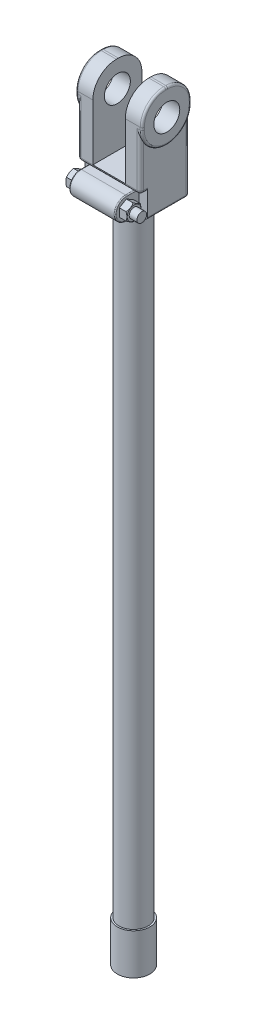
from build123d import *

# Parameters (mm, degrees)
CROQUIS1_R              = 15.875
SALIENTE_EXTRUIR1_DEPTH = 40
CROQUIS2_R              = 14.2875
SALIENTE_EXTRUIR2_DEPTH = 615
CROQUIS3_W              = 65
CROQUIS3_H              = 48
SALIENTE_EXTRUIR3_DEPTH = 105
CROQUIS4_W              = 31.75
CROQUIS4_H              = 48
CORTAR_EXTRUIR1_DEPTH   = 78
REDONDEO1_R             = 23
CROQUIS5_R              = 12.7
CORTAR_EXTRUIR2_DEPTH   = 78
CORTAR_EXTRUIR3_DEPTH   = 2
CORTAR_EXTRUIR4_START   = -2
CORTAR_EXTRUIR4_DEPTH   = 2
REDONDEO3_R             = 3
REDONDEO4_START         = 654
REDONDEO4_DEPTH         = 56.5999999
REDONDEO4_START_2       = 710.5999999
REDONDEO4_2_DEPTH       = 24.0000002
REDONDEO4_START_3       = 27.4999999
REDONDEO4_3_DEPTH       = 3.0000001
REDONDEO4_START_4       = -30.5
REDONDEO4_4_DEPTH       = 3
REDONDEO5_R             = 2
REDONDEO6_R             = 2
CROQUIS9_W              = 7
CROQUIS9_H              = 24
CORTAR_EXTRUIR5_DEPTH   = 80
SALIENTE_EXTRUIR4_DEPTH = 53
REDONDEO7_R             = 3
CORTAR_EXTRUIR6_DEPTH   = 8
CROQUIS14_R             = 4.7625
CORTAR_EXTRUIR7_DEPTH   = 45
SALIENTE_EXTRUIR5_DEPTH = 7.5
CROQUIS16_R             = 6.71931732
CORTAR_EXTRUIR8_DEPTH   = 3
CORTAR_EXTRUIR8_DRAFT   = -64
REDONDEO8_R             = 1
CROQUIS17_R             = 4.7625
SALIENTE_EXTRUIR6_DEPTH = 60
CROQUIS18_R             = 4.7625
SALIENTE_EXTRUIR7_DEPTH = 7.5
CROQUIS19_R             = 6.761258256
CORTAR_EXTRUIR9_DEPTH   = 4
CORTAR_EXTRUIR9_DRAFT   = -52


with BuildPart() as part:
    # Croquis1 → Saliente-Extruir1 (new body)
    with BuildSketch(Plane(origin=(0, 0, 0), x_dir=(1, 0, 0), z_dir=(0, 1, 0))):
        with Locations(Location((0, 0, 0), (0, 0, 270))):
            Circle(CROQUIS1_R)
    extrude(amount=SALIENTE_EXTRUIR1_DEPTH)

    # Croquis2 → Saliente-Extruir2 (add)
    with BuildSketch(Plane(origin=(0, 40, 0), x_dir=(1, 0, 0), z_dir=(0, 1, 0))):
        with Locations(Location((0, 0, 0), (0, 0, 270))):
            Circle(CROQUIS2_R)
    extrude(amount=SALIENTE_EXTRUIR2_DEPTH)

    # Croquis3 → Saliente-Extruir3 (add)
    with BuildSketch(Plane(origin=(0, 655, 0), x_dir=(1, 0, 0), z_dir=(0, 1, 0))):
        Rectangle(CROQUIS3_W, CROQUIS3_H)
    extrude(amount=SALIENTE_EXTRUIR3_DEPTH)

    # Croquis4 → Cortar-Extruir1 (cut)
    with BuildSketch(Plane(origin=(0, 760, 0), x_dir=(1, 0, 0), z_dir=(0, 1, 0))):
        Rectangle(CROQUIS4_W, CROQUIS4_H)
    extrude(amount=-CORTAR_EXTRUIR1_DEPTH, mode=Mode.SUBTRACT)

    # Redondeo1
    redondeo1_edges = [part.edges().sort_by_distance(p)[0] for p in [
        (24.1875, 760, -24),
        (-24.1875, 760, 24),
        (-24.1875, 760, -24),
        (24.1875, 760, 24),
    ]]
    fillet(redondeo1_edges, radius=REDONDEO1_R)

    # Croquis5 → Cortar-Extruir2 (cut)
    with BuildSketch(Plane(origin=(32.5, 0, 0), x_dir=(0, 0, -1), z_dir=(1, 0, 0))):
        with Locations((0, 734.6)):
            Circle(CROQUIS5_R)
    extrude(amount=-CORTAR_EXTRUIR2_DEPTH, mode=Mode.SUBTRACT)

    # Croquis6 → Cortar-Extruir3 (cut)
    with BuildSketch(Plane(origin=(32.5, 0, 0), x_dir=(0, 0, -1), z_dir=(1, 0, 0))):
        with BuildLine():
            Line((24, 734.6), (24, 655))
            Line((24, 655), (-24, 655))
            Line((-24, 655), (-24, 734.6))
            ThreePointArc((-24, 734.6), (0, 710.6), (24, 734.6))
        make_face()
    extrude(amount=-CORTAR_EXTRUIR3_DEPTH, mode=Mode.SUBTRACT)

    # Croquis7 → Cortar-Extruir4 (cut)
    with BuildSketch(Plane.ZY.offset(32.5).offset(CORTAR_EXTRUIR4_START)):
        with BuildLine():
            Line((-24, 734.6), (-24, 655))
            Line((-24, 655), (24, 655))
            Line((24, 655), (24, 734.6))
            ThreePointArc((24, 734.6), (0, 710.6), (-24, 734.6))
        make_face()
    extrude(amount=CORTAR_EXTRUIR4_DEPTH, mode=Mode.SUBTRACT)

    # Redondeo3
    redondeo3_edges = [part.edges().sort_by_distance(p)[0] for p in [
        (30.5, 694.8, -24),
        (-30.5, 694.8, -24),
    ]]
    fillet(redondeo3_edges, radius=REDONDEO3_R)

    # Redondeo4: read off the stored shape, not the designer's step
    # Redondeo4 outline → Redondeo4 (cut)
    with BuildSketch(Plane(origin=(0, 0, 0), x_dir=(1, 0, 0), z_dir=(0, 1, 0)).offset(REDONDEO4_START)):
        with BuildLine():
            ThreePointArc((30.5, -21), (29.621320344, -23.121320344), (27.5, -24))
            Line((27.5, -24), (30.5, -24))
            Line((30.5, -24), (30.5, -21))
        make_face()
        with BuildLine():
            Line((-30.5, -24), (-27.5, -24))
            ThreePointArc((-27.5, -24), (-29.621320344, -23.121320344), (-30.5, -21))
            Line((-30.5, -21), (-30.5, -24))
        make_face()
    extrude(amount=REDONDEO4_DEPTH, mode=Mode.SUBTRACT)

    # Redondeo4 2 outline → Redondeo4 2 (cut)
    with BuildSketch(Plane(origin=(0, 0, 0), x_dir=(1, 0, 0), z_dir=(0, 1, 0)).offset(REDONDEO4_START_2)):
        with BuildLine():
            ThreePointArc((30.5, -21), (29.621320344, -23.121320344), (27.5, -24))
            Line((27.5, -24), (30.5, -24))
            Line((30.5, -24), (30.5, -21))
        make_face()
        with BuildLine():
            Line((-30.5, -24), (-27.5, -24))
            ThreePointArc((-27.5, -24), (-29.621320344, -23.121320344), (-30.5, -21))
            Line((-30.5, -21), (-30.5, -24))
        make_face()
    extrude(amount=REDONDEO4_2_DEPTH, mode=Mode.SUBTRACT)

    # Redondeo4 3 outline → Redondeo4 3 (add)
    with BuildSketch(Plane.YZ.offset(REDONDEO4_START_3)):
        with BuildLine():
            Line((734.6000001, 21), (734.6, 24))
            ThreePointArc((734.6, 24), (728.6, 23.237900077), (722.981049961, 21))
            Line((722.981049961, 21), (734.6000001, 21))
        make_face()
    extrude(amount=REDONDEO4_3_DEPTH)

    # Redondeo4 4 outline → Redondeo4 4 (add)
    with BuildSketch(Plane.YZ.offset(REDONDEO4_START_4)):
        with BuildLine():
            Line((734.6000001, 21), (734.6, 24))
            ThreePointArc((734.6, 24), (728.6, 23.237900077), (722.981049961, 21))
            Line((722.981049961, 21), (734.6000001, 21))
        make_face()
    extrude(amount=REDONDEO4_4_DEPTH)

    # Redondeo5
    redondeo5_edges = [part.edges().sort_by_distance(p)[0] for p in [
        (-32.5, 760, 0),
        (-32.5, 735.8, 24),
        (32.5, 735.8, 24),
        (-32.5, 735.8, -24),
        (-32.5, 753.263455967, -17.263455967),
        (-32.5, 753.263455967, 17.263455967),
        (32.5, 735.8, -24),
        (32.5, 760, 0),
        (32.5, 753.263455967, -17.263455967),
        (32.5, 753.263455967, 17.263455967),
        (32.5, 710.6, 0),
        (-32.5, 710.6, 0),
    ]]
    fillet(redondeo5_edges, radius=REDONDEO5_R - 0.0001)  # a hair under: the kernel refuses the full size

    # Redondeo6
    redondeo6_edges = [part.edges().sort_by_distance(p)[0] for p in [
        (-30.5, 655, 0),
        (0, 655, -24),
        (29.621320344, 655, -23.121320344),
        (-29.621320344, 655, -23.121320344),
        (30.5, 655, 0),
        (0, 655, 24),
        (-29.621320344, 655, 23.121320344),
        (29.621320344, 655, 23.121320344),
    ]]
    fillet(redondeo6_edges, radius=REDONDEO6_R)

    # Croquis9 → Cortar-Extruir5 (cut)
    with BuildSketch(Plane.ZY.offset(30.5)):
        with Locations((20.5, 667)):
            Rectangle(CROQUIS9_W, CROQUIS9_H)
    extrude(amount=-CORTAR_EXTRUIR5_DEPTH, mode=Mode.SUBTRACT)

    # Croquis10 → Saliente-Extruir4 (add)
    with BuildSketch(Plane.ZY.offset(30.5)):
        with BuildLine():
            Line((29.5, 678), (17, 678))
            Line((17, 678), (17, 656))
            Line((17, 656), (29.5, 656))
            ThreePointArc((29.5, 656), (40.5, 667), (29.5, 678))
        make_face()
    extrude(amount=-SALIENTE_EXTRUIR4_DEPTH)

    # Redondeo7
    redondeo7_edges = [part.edges().sort_by_distance(p)[0] for p in [
        (-29.621320344, 679, 23.121320344),
        (30.5, 679, 19),
        (29.621320344, 679, 23.121320344),
        (-30.5, 679, 19),
        (0, 679, 24),
    ]]
    fillet(redondeo7_edges, radius=REDONDEO7_R - 0.0001)  # a hair under: the kernel refuses the full size

    # Croquis11 → Cortar-Extruir6 (cut)
    with BuildSketch(Plane.ZY.offset(30.5)):
        with BuildLine():
            Line((29.5, 678), (17, 678))
            Line((17, 678), (17, 656))
            Line((17, 656), (29.5, 656))
            ThreePointArc((29.5, 656), (40.5, 667), (29.5, 678))
        make_face()
    extrude(amount=-CORTAR_EXTRUIR6_DEPTH, mode=Mode.SUBTRACT)

    # Croquis14 → Cortar-Extruir7 (cut)
    with BuildSketch(Plane.ZY.offset(22.5)):
        with Locations((29.5, 667)):
            Circle(CROQUIS14_R)
    extrude(amount=-CORTAR_EXTRUIR7_DEPTH, mode=Mode.SUBTRACT)

    # Croquis15 → Saliente-Extruir5 (add)
    with BuildSketch(Plane.ZY.offset(22.5)):
        Polygon((29.5, 659), (36.42820323, 663), (36.42820323, 671), (29.5, 675), (22.57179677, 671), (22.57179677, 663), align=None)
    extrude(amount=SALIENTE_EXTRUIR5_DEPTH)


with BuildPart() as cortar_extruir8_tool:
    # Croquis16 → Cortar-Extruir8 (with draft: the straight prism first)
    with BuildSketch(Plane.ZY.offset(30)):
        with BuildLine():
            Line((24.729588918, 691.570175939), (24.729588918, 678.749945473))
            Line((24.729588918, 678.749945473), (17.351920944, 678.749945473))
            Line((17.351920944, 678.749945473), (17.351920944, 645.064765076))
            ThreePointArc((17.351920944, 645.064765076), (54.036709128, 663.082957146), (24.729588918, 691.570175939))
        make_face()
        with Locations((29.345480417, 667)):
            Circle(CROQUIS16_R, mode=Mode.SUBTRACT)
    extrude(amount=-CORTAR_EXTRUIR8_DEPTH)
    # Cortar-Extruir8: the draft: its side faces are tilted about the plane it starts from
    cortar_extruir8_sides = [cortar_extruir8_tool.faces().sort_by_distance(p)[0] for p in [
        (-28.5, 685.160060706, 24.729588918),
        (-28.5, 678.749945473, 21.040754931),
        (-28.5, 661.907355274, 17.351920944),
        (-28.5, 663.082957146, 54.036709128),
        (-28.5, 667, 22.626163097),
    ]]
    draft(cortar_extruir8_sides, Plane.ZY.offset(30), CORTAR_EXTRUIR8_DRAFT)


with BuildPart() as part_1:
    add(part.part)

    # Cortar-Extruir8: cut by cortar_extruir8_tool
    add(cortar_extruir8_tool.part, mode=Mode.SUBTRACT)

    # Redondeo8
    redondeo8_edges = [part_1.edges().sort_by_distance(p)[0] for p in [
        (22.5, 667, 40.5),
        (22.5, 656, 23.25),
        (22.5, 678, 23.25),
        (-22.5, 667, 40.5),
        (-22.5, 656, 23.25),
        (-22.5, 678, 23.25),
    ]]
    fillet(redondeo8_edges, radius=REDONDEO8_R)

    # Croquis17 → Saliente-Extruir6 (add)
    with BuildSketch(Plane(origin=(-22.5, 0, 0), x_dir=(0, 0, -1), z_dir=(1, 0, 0))):
        with Locations(Location((-29.5, 667, 0), (0, 0, 180))):
            Circle(CROQUIS17_R)
    extrude(amount=SALIENTE_EXTRUIR6_DEPTH)

    # Croquis18 → Saliente-Extruir7 (add)
    with BuildSketch(Plane(origin=(22.5, 0, 0), x_dir=(0, 0, -1), z_dir=(1, 0, 0))):
        Polygon((-29.5, 675), (-36.42820323, 671), (-36.42820323, 663), (-29.5, 659), (-22.57179677, 663), (-22.57179677, 671), align=None)
        with Locations((-29.5, 667)):
            Circle(CROQUIS18_R, mode=Mode.SUBTRACT)
    extrude(amount=SALIENTE_EXTRUIR7_DEPTH)


with BuildPart() as cortar_extruir9_tool:
    # Croquis19 → Cortar-Extruir9 (with draft: the straight prism first)
    with BuildSketch(Plane(origin=(30, 0, 0), x_dir=(0, 0, -1), z_dir=(1, 0, 0))):
        with BuildLine():
            ThreePointArc((-24.252980935, 686.078510345), (-48.88237086, 663.019489242), (-17.15857321, 651.533586361))
            Line((-17.15857321, 651.533586361), (-17.15857321, 678.754417994))
            Line((-17.15857321, 678.754417994), (-24.252980935, 678.754417994))
            Line((-24.252980935, 678.754417994), (-24.252980935, 686.078510345))
        make_face()
        with Locations((-29.5, 667)):
            Circle(CROQUIS19_R, mode=Mode.SUBTRACT)
    extrude(amount=-CORTAR_EXTRUIR9_DEPTH)
    # Cortar-Extruir9: the draft: its side faces are tilted about the plane it starts from
    cortar_extruir9_sides = [cortar_extruir9_tool.faces().sort_by_distance(p)[0] for p in [
        (28, 665.144002178, 17.15857321),
        (28, 678.754417994, 20.705777072),
        (28, 682.41646417, 24.252980935),
        (28, 663.019489242, 48.88237086),
        (28, 667, 36.261258256),
    ]]
    draft(cortar_extruir9_sides, Plane(origin=(30, 0, 0), x_dir=(0, 0, -1), z_dir=(1, 0, 0)), CORTAR_EXTRUIR9_DRAFT)


with BuildPart() as part_2:
    add(part_1.part)

    # Cortar-Extruir9: cut by cortar_extruir9_tool
    add(cortar_extruir9_tool.part, mode=Mode.SUBTRACT)


solid = part_2.part
